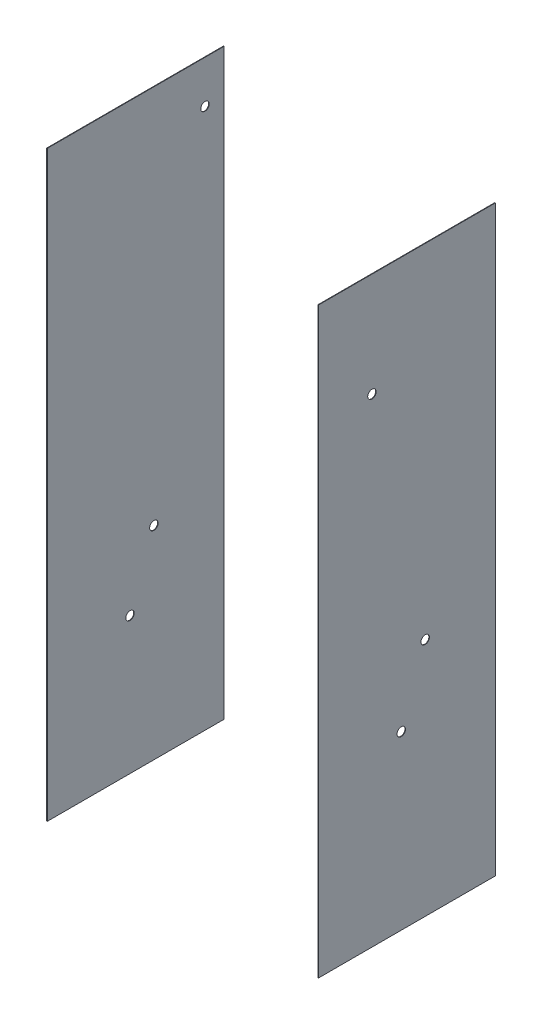
from build123d import *

# Parameters (mm, degrees)
BOSS_EXTRUDE1_OUTLINE_W = 596.9
BOSS_EXTRUDE1_OUTLINE_H = 1968.5
BOSS_EXTRUDE1_DEPTH     = 1.778
SKETCH3_R               = 14.2875
CUT_EXTRUDE1_DEPTH      = 2.54
CUT_EXTRUDE2_DEPTH      = 34.798
CUT_EXTRUDE2_DEPTH_BACK = 16.002
SKETCH4_R               = 14.2875


# Read off the part's stored shape, not the designer's step: Boss-Extrude1
with BuildPart() as part:
    # Boss-Extrude1 outline → Boss-Extrude1 (new body)
    with BuildSketch(Plane(origin=(457.2, 0, 0), x_dir=(0, 0, -1), z_dir=(1, 0, 0))):
        Rectangle(BOSS_EXTRUDE1_OUTLINE_W, BOSS_EXTRUDE1_OUTLINE_H)
    extrude(amount=BOSS_EXTRUDE1_DEPTH)


with BuildPart() as body_2:
    # Mirror7: mirrored copy
    add(part.part.mirror(Plane(origin=(0, 0, 0), x_dir=(0, 0, 1), z_dir=(1, 0, 0))))

    # Sketch4 → Cut-Extrude2 (cut, two sides: drawn at the far end of the back side and taken through both)
    with BuildSketch(Plane.ZY.offset(457.2).offset(-CUT_EXTRUDE2_DEPTH_BACK)):
        with Locations((-234.315, 840.698755889)):
            Circle(SKETCH4_R)
        with Locations((-61.7093, -298.923044111)):
            Circle(SKETCH4_R)
        with Locations((19.05, -522.150944111)):
            Circle(SKETCH4_R)
    extrude(amount=CUT_EXTRUDE2_DEPTH + CUT_EXTRUDE2_DEPTH_BACK, mode=Mode.SUBTRACT)


with BuildPart() as part_1:
    add(part.part)

    # Sketch3 → Cut-Extrude1 (cut)
    with BuildSketch(Plane(origin=(458.978, 0, 0), x_dir=(0, 0, -1), z_dir=(1, 0, 0))):
        with Locations((61.7093, -174.68596)):
            Circle(SKETCH3_R)
        with Locations((-19.05, -403.46376)):
            Circle(SKETCH3_R)
        with Locations((-118.0338, 633.21184)):
            Circle(SKETCH3_R)
    extrude(amount=-CUT_EXTRUDE1_DEPTH, mode=Mode.SUBTRACT)


solid = Compound([body_2.part, part_1.part])
